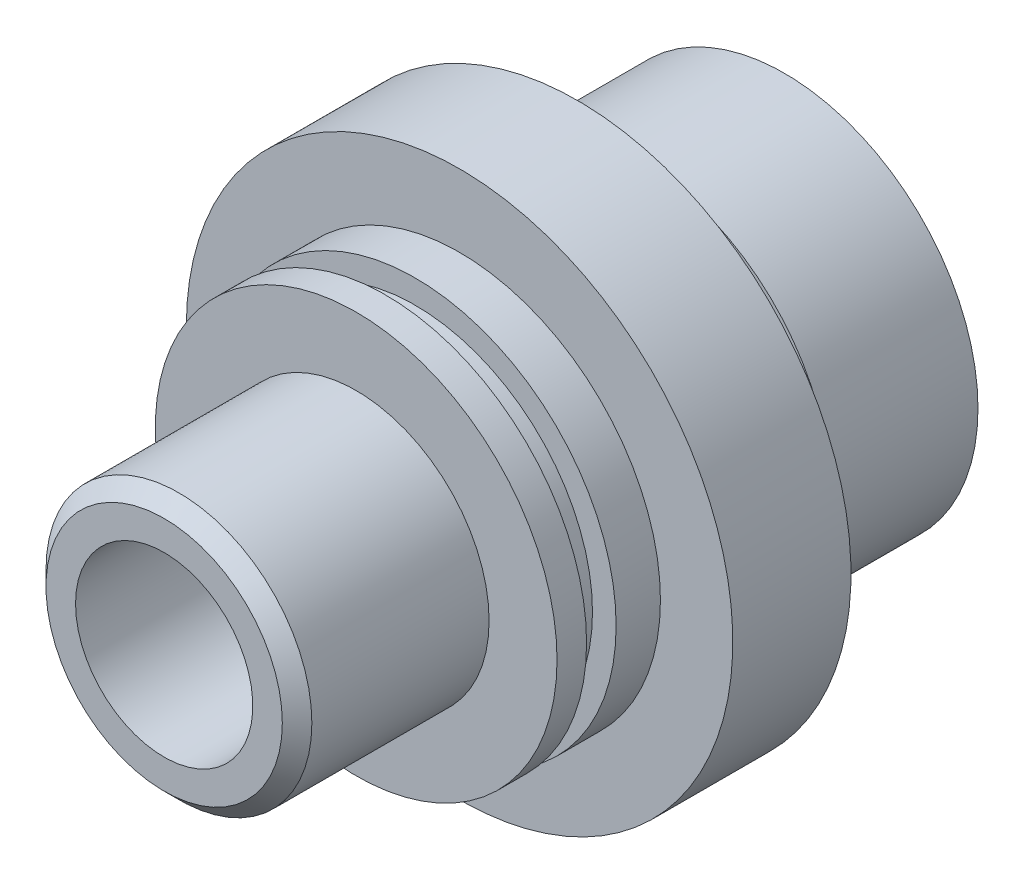
from build123d import *

# Parameters (mm, degrees)
SKETCH1_R           = 9.25
SKETCH1_R_2         = 3
BOSS_EXTRUDE1_DEPTH = 21
SKETCH2_OUTSIDE_W   = 27.21
SKETCH2_OUTSIDE_H   = 27.21
SKETCH2_OUTSIDE_R   = 4.5
CUT_EXTRUDE1_DEPTH  = 6.5
SKETCH3_OUTSIDE_W   = 27.21
SKETCH3_OUTSIDE_H   = 27.21
SKETCH3_OUTSIDE_R   = 6.8
CUT_EXTRUDE2_DEPTH  = 3.5
CUT_EXTRUDE3_START  = -1
SKETCH4_OUTSIDE_W   = 27.21
SKETCH4_OUTSIDE_H   = 27.21
SKETCH4_OUTSIDE_R   = 6
CUT_EXTRUDE3_DEPTH  = 1
SKETCH5_OUTSIDE_W   = 27.21
SKETCH5_OUTSIDE_H   = 27.21
SKETCH5_OUTSIDE_R   = 6.55
CUT_EXTRUDE5_DEPTH  = 7
CUT_EXTRUDE6_START  = -8
SKETCH6_R           = 7.5
SKETCH6_R_2         = 6
CUT_EXTRUDE6_DEPTH  = 3
CHAMFER1_SIZE       = 0.5


with BuildPart() as part:
    # Sketch1 → Boss-Extrude1 (new body)
    with BuildSketch(Plane.XY):
        Circle(SKETCH1_R)
        Circle(SKETCH1_R_2, mode=Mode.SUBTRACT)
    extrude(amount=BOSS_EXTRUDE1_DEPTH)

    # Sketch2 outside → Cut-Extrude1 (cut)
    with BuildSketch(Plane.XY.offset(21)):
        Rectangle(SKETCH2_OUTSIDE_W, SKETCH2_OUTSIDE_H)
        Circle(SKETCH2_OUTSIDE_R, mode=Mode.SUBTRACT)
    extrude(amount=-CUT_EXTRUDE1_DEPTH, mode=Mode.SUBTRACT)

    # Sketch3 outside → Cut-Extrude2 (cut)
    with BuildSketch(Plane.XY.offset(14.5)):
        Rectangle(SKETCH3_OUTSIDE_W, SKETCH3_OUTSIDE_H)
        Circle(SKETCH3_OUTSIDE_R, mode=Mode.SUBTRACT)
    extrude(amount=-CUT_EXTRUDE2_DEPTH, mode=Mode.SUBTRACT)

    # Sketch4 outside → Cut-Extrude3 (cut)
    with BuildSketch(Plane.XY.offset(14.5).offset(CUT_EXTRUDE3_START)):
        Rectangle(SKETCH4_OUTSIDE_W, SKETCH4_OUTSIDE_H)
        Circle(SKETCH4_OUTSIDE_R, mode=Mode.SUBTRACT)
    extrude(amount=-CUT_EXTRUDE3_DEPTH, mode=Mode.SUBTRACT)

    # Sketch5 outside → Cut-Extrude5 (cut)
    with BuildSketch(Plane(origin=(0, 0, 0), x_dir=(-1, 0, 0), z_dir=(0, 0, -1))):
        Rectangle(SKETCH5_OUTSIDE_W, SKETCH5_OUTSIDE_H)
        Circle(SKETCH5_OUTSIDE_R, mode=Mode.SUBTRACT)
    extrude(amount=-CUT_EXTRUDE5_DEPTH, mode=Mode.SUBTRACT)

    # Sketch6 → Cut-Extrude6 (cut)
    with BuildSketch(Plane(origin=(0, 0, 0), x_dir=(-1, 0, 0), z_dir=(0, 0, -1)).offset(CUT_EXTRUDE6_START)):
        Circle(SKETCH6_R)
        Circle(SKETCH6_R_2, mode=Mode.SUBTRACT)
    extrude(amount=CUT_EXTRUDE6_DEPTH, mode=Mode.SUBTRACT)

    # Chamfer1
    chamfer1_edges = [part.edges().sort_by_distance(p)[0] for p in [
        (-4.5, 0, 21),
    ]]
    chamfer(chamfer1_edges, length=CHAMFER1_SIZE)


solid = part.part
